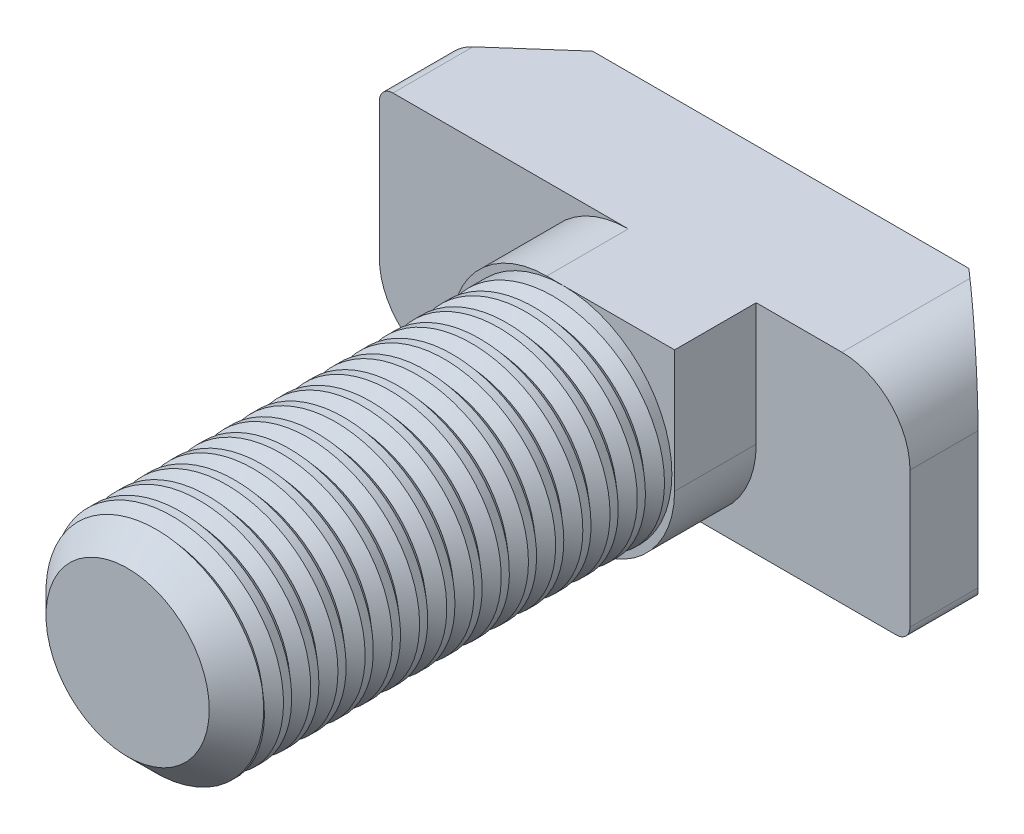
from build123d import *

# Parameters (mm, degrees)
SKETCH_1_W          = 19.5
SKETCH_1_H          = 8
EXTRUDE_1_DEPTH     = 5
FILLET_1_R          = 2.5
FILLET_2_R          = 0.5
CUT_EXTRUDE_2_DEPTH = 14.566963551
SKETCH_3_W          = 8.2
SKETCH_3_H          = 8
EXTRUDE_2_DEPTH     = 3
FILLET_3_R          = 3.5
SKETCH_4_R          = 4
EXTRUDE_3_DEPTH     = 16
CHAMFER_1_SIZE      = 1
SWEEP_1_PITCH       = 1


with BuildPart() as part:
    # 草图1 → 凸台-拉伸1 (new body)
    with BuildSketch(Plane.XY):
        Rectangle(SKETCH_1_W, SKETCH_1_H)
    extrude(amount=EXTRUDE_1_DEPTH)

    # 圆角1
    fillet_1_edges = [part.edges().sort_by_distance(p)[0] for p in [
        (-9.75, -4, 2.5),
        (9.75, 4, 2.5),
    ]]
    fillet(fillet_1_edges, radius=FILLET_1_R)

    # 圆角2
    fillet_2_edges = [part.edges().sort_by_distance(p)[0] for p in [
        (9.75, -4, 2.5),
        (-9.75, 4, 2.5),
    ]]
    fillet(fillet_2_edges, radius=FILLET_2_R)

    # 草图2 → 切除-拉伸2 (cut, through all)
    with BuildSketch(Plane.XZ.offset(4)):
        Polygon((-9.75, 2.5), (-6.914115374, 0), (-9.75, 0), align=None)
    cut_extrude_2 = extrude(amount=-CUT_EXTRUDE_2_DEPTH, mode=Mode.SUBTRACT)

    # 镜向1: 切除-拉伸2 across plane
    add(cut_extrude_2.mirror(Plane(origin=(0, 0, 0), x_dir=(0, 0, 1), z_dir=(1, 0, 0))), mode=Mode.SUBTRACT)

    # 草图3 → 凸台-拉伸2 (add)
    with BuildSketch(Plane.XY.offset(5)):
        Rectangle(SKETCH_3_W, SKETCH_3_H)
    extrude(amount=EXTRUDE_2_DEPTH)

    # 圆角3
    fillet_3_edges = [part.edges().sort_by_distance(p)[0] for p in [
        (4.1, -4, 6.5),
        (-4.1, 4, 6.5),
    ]]
    fillet(fillet_3_edges, radius=FILLET_3_R)

    # 草图4 → 凸台-拉伸3 (add)
    with BuildSketch(Plane.XY.offset(8)):
        with Locations(Location((0, 0, 0), (0, 0, 270))):
            Circle(SKETCH_4_R)
    extrude(amount=EXTRUDE_3_DEPTH)

    # 倒角1
    chamfer_1_edges = [part.edges().sort_by_distance(p)[0] for p in [
        (0, 4, 24),
    ]]
    chamfer(chamfer_1_edges, length=CHAMFER_1_SIZE)

    # 切除-扫描1: arcs per turn and ends read off the stored shape
    # 切除-扫描1: the profile of 草图6 profile screwed along a right-hand helix through 16 turns, 8 arcs to a turn; built about Z, then put on its axis
    sweep_1_z = Axis((0, 0, 0), (0, 0, 1))
    sweep_1_corners = [(4.0003, 0, 0.3502625), (4.0003, 0, -0.3502625), (3.6, 0, 0)]
    with BuildLine(mode=Mode.PRIVATE) as sweep_1_profile:
        Line(sweep_1_corners[0], sweep_1_corners[1])
        Line(sweep_1_corners[1], sweep_1_corners[2])
        Line(sweep_1_corners[2], sweep_1_corners[0])
    sweep_1_cap = Face(sweep_1_profile.wire())
    sweep_1_turn_angles = [0, 22.5, 45, 67.5, 90, 112.5, 135, 157.5, 180, 202.5, 225, 247.5, 270, 292.5, 315, 337.5, 360]
    sweep_1_turn_weights = [1, 0.9238795325112867, 1, 0.9238795325112867, 1, 0.9238795325112867, 1, 0.9238795325112867, 1, 0.9238795325112867, 1, 0.9238795325112867, 1, 0.9238795325112867, 1, 0.9238795325112867, 1]
    sweep_1_turn_rails = [Edge.make_bspline([Vector(p[0], p[1], 0).rotate(sweep_1_z, sweep_1_turn_angles[k]) / sweep_1_turn_weights[k] + Vector(0, 0, p[2] + SWEEP_1_PITCH * sweep_1_turn_angles[k] / 360) for k in range(17)], [0, 0, 0, 1, 1, 2, 2, 3, 3, 4, 4, 5, 5, 6, 6, 7, 7, 8, 8, 8], 2, sweep_1_turn_weights) for p in sweep_1_corners]
    sweep_1_turn_sides = [Face.make_surface_from_curves(sweep_1_turn_rails[p[0]], sweep_1_turn_rails[p[1]]) for p in [(0, 1), (1, 2), (2, 0)]]
    sweep_1 = Plane(origin=(0, 0, 24), x_dir=(-0.7071067811865512, 0.7071067811865438, 0), z_dir=(0, 0, -1)) * Solid(Shell([*[p.moved(Location((0, 0, SWEEP_1_PITCH * i))) for i in range(16) for p in sweep_1_turn_sides], sweep_1_cap, sweep_1_cap.rotate(sweep_1_z, 5760).moved(Location((0, 0, SWEEP_1_PITCH * 5760 / 360)))]))
    add(sweep_1, mode=Mode.SUBTRACT)


solid = part.part
